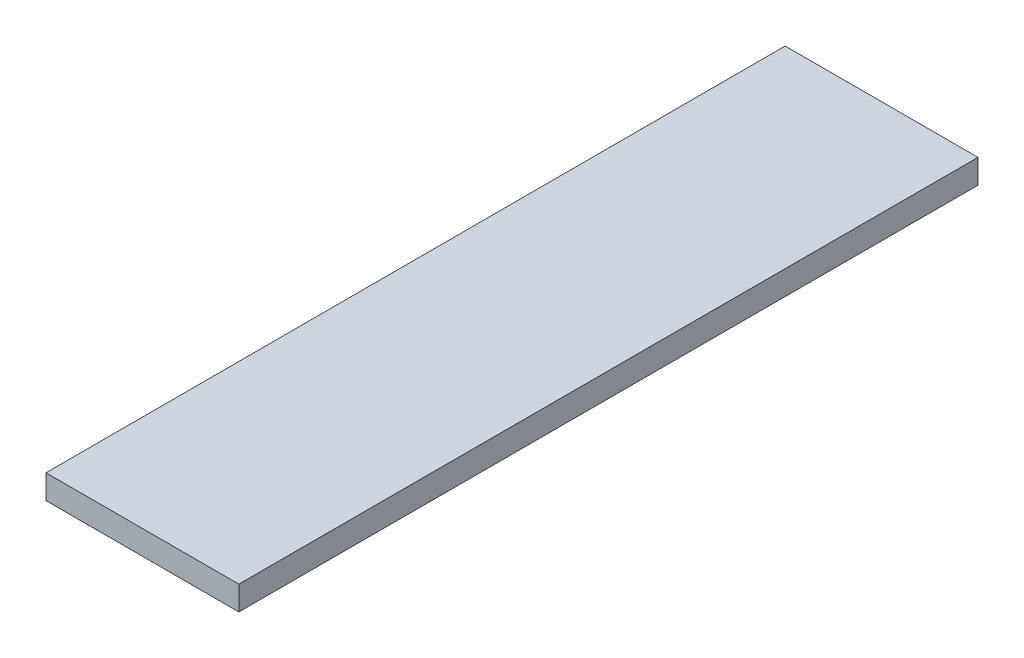
from build123d import *

# Parameters (mm, degrees)
SKETCH1_W           = 152.4
SKETCH1_H           = 584.2
BOSS_EXTRUDE1_DEPTH = 19.05


with BuildPart() as part:
    # Sketch1 → Boss-Extrude1 (new body)
    with BuildSketch(Plane(origin=(0, 0, 0), x_dir=(1, 0, 0), z_dir=(0, 1, 0))):
        with Locations((76.2, 292.1)):
            Rectangle(SKETCH1_W, SKETCH1_H)
    extrude(amount=BOSS_EXTRUDE1_DEPTH)


solid = part.part
